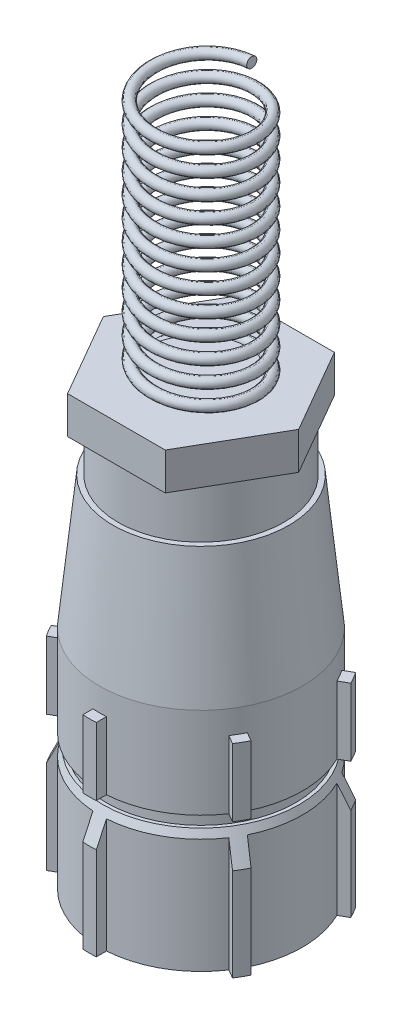
from build123d import *

# Parameters (mm, degrees)
SKETCH_1_R          = 15
EXTRUDE_1_DEPTH     = 33
EXTRUDE_2_DEPTH     = 10
SKETCH_3_R          = 12.25
EXTRUDE_3_DEPTH     = 13
SKETCH_5_R          = 14
EXTRUDE_4_DEPTH     = 2
EXTRUDE_START       = 19
SKETCH_6_R          = 16.5
EXTRUDE_5_DEPTH     = 19
SKETCH_7_R          = 13.5
SKETCH_7_R_2        = 11
CUT_EXTRUDE_2_DEPTH = 9
SKETCH_8_R          = 16.5
SKETCH_8_R_2        = 13.5
CUT_EXTRUDE_3_DEPTH = 1
SKETCH_9_R          = 0.75
CUT_EXTRUDE_4_DEPTH = 4
CHAMFER_1_SIZE      = 2
CHAMFER_1_SIZE2     = 4.289013841
CUT_EXTRUDE_5_DEPTH = 18
SKETCH_11_R         = 7.5
EXTRUDE_6_DEPTH     = 1
SWEEP_1_PITCH       = 3
EXTRUDE_8_DEPTH     = 5.5


with BuildPart() as part:
    # Эскиз1 → Бобышка-Вытянуть1 (new body)
    with BuildSketch(Plane(origin=(0, 0, 0), x_dir=(1, 0, 0), z_dir=(0, 1, 0))):
        with Locations(Location((0, 0, 0), (0, 0, 270))):
            Circle(SKETCH_1_R)
    extrude(amount=EXTRUDE_1_DEPTH)

    # Эскиз2 → Бобышка-Вытянуть2 (add)
    with BuildSketch(Plane.XZ):
        with BuildLine():
            ThreePointArc((1, 16.469669092), (0.500229938, 16.49241553), (0, 16.5))
            Line((0, 16.5), (0, 15))
            ThreePointArc((0, 15), (0.500278319, 14.991655066), (1, 14.966629547))
            Line((1, 14.966629547), (1, 16.469669092))
        make_face()
        with BuildLine():
            Line((0, 15), (0, 16.5))
            ThreePointArc((0, 16.5), (-0.500229938, 16.49241553), (-1, 16.469669092))
            Line((-1, 16.469669092), (-1, 14.966629547))
            ThreePointArc((-1, 14.966629547), (-0.500278319, 14.991655066), (0, 15))
        make_face()
        with BuildLine():
            ThreePointArc((-13.461481397, 6.61728937), (-12.990381057, 7.5), (-12.461481397, 8.349340177))
            Line((-12.461481397, 8.349340177), (-13.763151826, 9.10085995))
            ThreePointArc((-13.763151826, 9.10085995), (-14.289419162, 8.25), (-14.763151826, 7.368809142))
            Line((-14.763151826, 7.368809142), (-13.461481397, 6.61728937))
        make_face()
        with BuildLine():
            Line((13.763151826, 9.10085995), (12.461481397, 8.349340177))
            ThreePointArc((12.461481397, 8.349340177), (12.990381057, 7.5), (13.461481397, 6.61728937))
            Line((13.461481397, 6.61728937), (14.763151826, 7.368809142))
            ThreePointArc((14.763151826, 7.368809142), (14.289419162, 8.25), (13.763151826, 9.10085995))
        make_face()
        with BuildLine():
            ThreePointArc((13.461481397, -6.61728937), (12.990381057, -7.5), (12.461481397, -8.349340177))
            Line((12.461481397, -8.349340177), (13.763151826, -9.10085995))
            ThreePointArc((13.763151826, -9.10085995), (14.289419162, -8.25), (14.763151826, -7.368809142))
            Line((14.763151826, -7.368809142), (13.461481397, -6.61728937))
        make_face()
        with BuildLine():
            Line((0, -16.5), (0, -15))
            ThreePointArc((0, -15), (-0.500278319, -14.991655066), (-1, -14.966629547))
            Line((-1, -14.966629547), (-1, -16.469669092))
            ThreePointArc((-1, -16.469669092), (-0.500229938, -16.49241553), (0, -16.5))
        make_face()
        with BuildLine():
            ThreePointArc((1, -14.966629547), (0.500278319, -14.991655066), (0, -15))
            Line((0, -15), (0, -16.5))
            ThreePointArc((0, -16.5), (0.500229938, -16.49241553), (1, -16.469669092))
            Line((1, -16.469669092), (1, -14.966629547))
        make_face()
        with BuildLine():
            Line((-13.763151826, -9.10085995), (-12.461481397, -8.349340177))
            ThreePointArc((-12.461481397, -8.349340177), (-12.990381057, -7.5), (-13.461481397, -6.61728937))
            Line((-13.461481397, -6.61728937), (-14.763151826, -7.368809142))
            ThreePointArc((-14.763151826, -7.368809142), (-14.289419162, -8.25), (-13.763151826, -9.10085995))
        make_face()
    extrude(amount=-EXTRUDE_2_DEPTH)

    # Эскиз5 → Бобышка-Вытянуть4 (add)
    with BuildSketch(Plane.XZ):
        with Locations(Location((0, 0, 0), (0, 0, 90))):
            Circle(SKETCH_5_R)
    extrude(amount=EXTRUDE_4_DEPTH)

    # Эскиз6 → Бобышка-Вытянуть5 (add)
    with BuildSketch(Plane.XZ.offset(2).offset(EXTRUDE_START)):
        with Locations(Location((0, 0, 0), (0, 0, 270))):
            Circle(SKETCH_6_R)
    extrude(amount=-EXTRUDE_5_DEPTH)

    # Эскиз7 → Вырез-Вытянуть2 (cut)
    with BuildSketch(Plane.XZ.offset(21)):
        with Locations(Location((0, 0, 0), (0, 0, 270))):
            Circle(SKETCH_7_R)
        with Locations(Location((0, 0, 0), (0, 0, 270))):
            Circle(SKETCH_7_R_2, mode=Mode.SUBTRACT)
    extrude(amount=-CUT_EXTRUDE_2_DEPTH, mode=Mode.SUBTRACT)

    # Эскиз8 → Вырез-Вытянуть3 (cut)
    with BuildSketch(Plane.XZ.offset(21)):
        with Locations(Location((0, 0, 0), (0, 0, 270))):
            Circle(SKETCH_8_R)
        with Locations(Location((0, 0, 0), (0, 0, 270))):
            Circle(SKETCH_8_R_2, mode=Mode.SUBTRACT)
    extrude(amount=-CUT_EXTRUDE_3_DEPTH, mode=Mode.SUBTRACT)

    # Эскиз9 → Вырез-Вытянуть4 (cut)
    with BuildSketch(Plane.XZ.offset(21)):
        with Locations(Location((-1.5, -2.598076211, 0), (0, 0, 270))):
            Circle(SKETCH_9_R)
        with Locations(Location((-3, 0, 0), (0, 0, 270))):
            Circle(SKETCH_9_R)
        with Locations(Location((0, 0, 0), (0, 0, 270))):
            Circle(SKETCH_9_R)
        with Locations(Location((1.5, -2.598076211, 0), (0, 0, 270))):
            Circle(SKETCH_9_R)
        with Locations(Location((3, 0, 0), (0, 0, 270))):
            Circle(SKETCH_9_R)
        with Locations(Location((3, -5.196152423, 0), (0, 0, 270))):
            Circle(SKETCH_9_R)
        with Locations(Location((6, 0, 0), (0, 0, 270))):
            Circle(SKETCH_9_R)
        with Locations(Location((-3, -5.196152423, 0), (0, 0, 270))):
            Circle(SKETCH_9_R)
        with Locations(Location((-4.5, -7.794228634, 0), (0, 0, 270))):
            Circle(SKETCH_9_R)
        with Locations(Location((4.5, -7.794228634, 0), (0, 0, 270))):
            Circle(SKETCH_9_R)
        with Locations(Location((9, 0, 0), (0, 0, 270))):
            Circle(SKETCH_9_R)
        with Locations(Location((-6, 0, 0), (0, 0, 270))):
            Circle(SKETCH_9_R)
        with Locations(Location((-9, 0, 0), (0, 0, 270))):
            Circle(SKETCH_9_R)
        with Locations(Location((-1.5, 2.598076211, 0), (0, 0, 270))):
            Circle(SKETCH_9_R)
        with Locations(Location((1.5, 2.598076211, 0), (0, 0, 270))):
            Circle(SKETCH_9_R)
        with Locations(Location((3, 5.196152423, 0), (0, 0, 270))):
            Circle(SKETCH_9_R)
        with Locations(Location((4.5, 7.794228634, 0), (0, 0, 270))):
            Circle(SKETCH_9_R)
        with Locations(Location((-3, 5.196152423, 0), (0, 0, 270))):
            Circle(SKETCH_9_R)
        with Locations(Location((-4.5, 7.794228634, 0), (0, 0, 270))):
            Circle(SKETCH_9_R)
    extrude(amount=-CUT_EXTRUDE_4_DEPTH, mode=Mode.SUBTRACT)

    # Фаска1
    chamfer_1_edges = [part.edges().sort_by_distance(p)[0] for p in [
        (0, -2, 16.5),
    ]]
    chamfer_1_side = [part.faces().sort_by_distance(p)[0] for p in [
        (0, -2, 16.033309524),
    ]]
    chamfer(chamfer_1_edges, length=CHAMFER_1_SIZE, length2=CHAMFER_1_SIZE2, reference=chamfer_1_side[0])

    # Эскиз10 → Вырез-Вытянуть5 (cut)
    with BuildSketch(Plane.XZ.offset(20)):
        with BuildLine():
            Line((1, 14.966629547), (1, 16.469669092))
            ThreePointArc((1, 16.469669092), (8.25, 14.289419162), (13.763151826, 9.10085995))
            Line((13.763151826, 9.10085995), (12.461481397, 8.349340177))
            ThreePointArc((12.461481397, 8.349340177), (7.5, 12.990381057), (1, 14.966629547))
        make_face()
        with BuildLine():
            Line((-1, 16.469669092), (-1, 14.966629547))
            ThreePointArc((-1, 14.966629547), (-7.5, 12.990381057), (-12.461481397, 8.349340177))
            Line((-12.461481397, 8.349340177), (-13.763151826, 9.10085995))
            ThreePointArc((-13.763151826, 9.10085995), (-8.25, 14.289419162), (-1, 16.469669092))
        make_face()
        with BuildLine():
            Line((-14.763151826, 7.368809142), (-13.461481397, 6.61728937))
            ThreePointArc((-13.461481397, 6.61728937), (-15, 0), (-13.461481397, -6.61728937))
            Line((-13.461481397, -6.61728937), (-14.763151826, -7.368809142))
            ThreePointArc((-14.763151826, -7.368809142), (-16.5, 0), (-14.763151826, 7.368809142))
        make_face()
        with BuildLine():
            Line((-13.763151826, -9.10085995), (-12.461481397, -8.349340177))
            ThreePointArc((-12.461481397, -8.349340177), (-7.5, -12.990381057), (-1, -14.966629547))
            Line((-1, -14.966629547), (-1, -16.469669092))
            ThreePointArc((-1, -16.469669092), (-8.25, -14.289419162), (-13.763151826, -9.10085995))
        make_face()
        with BuildLine():
            Line((1, -16.469669092), (1, -14.966629547))
            ThreePointArc((1, -14.966629547), (7.5, -12.990381057), (12.461481397, -8.349340177))
            Line((12.461481397, -8.349340177), (13.763151826, -9.10085995))
            ThreePointArc((13.763151826, -9.10085995), (8.25, -14.289419162), (1, -16.469669092))
        make_face()
        with BuildLine():
            Line((14.763151826, -7.368809142), (13.461481397, -6.61728937))
            ThreePointArc((13.461481397, -6.61728937), (15, 0), (13.461481397, 6.61728937))
            Line((13.461481397, 6.61728937), (14.763151826, 7.368809142))
            ThreePointArc((14.763151826, 7.368809142), (16.5, 0), (14.763151826, -7.368809142))
        make_face()
    extrude(amount=-CUT_EXTRUDE_5_DEPTH, mode=Mode.SUBTRACT)

    # Эскиз11 → Бобышка-Вытянуть6 (add)
    with BuildSketch(Plane(origin=(0, 33, 0), x_dir=(1, 0, 0), z_dir=(0, 1, 0))):
        with Locations(Location((0, 0, 0), (0, 0, 270))):
            Circle(SKETCH_11_R)
    extrude(amount=EXTRUDE_6_DEPTH)

    # По траектории1: arcs per turn and ends read off the stored shape
    # По траектории1: the profile of Эскиз15 screwed along a left-hand helix through 16 turns, 10 arcs to a turn; built about Z, then put on its axis
    sweep_1_z = Axis((0, 0, 0), (0, 0, 1))
    sweep_1_corners = [(8.25, 0, 0), (7.5, 0, 0.75), (6.75, 0, 0), (7.5, 0, -0.75)]
    with BuildLine(mode=Mode.PRIVATE) as sweep_1_profile:
        ThreePointArc((8.25, 0, 0), (8.030330086, 0, 0.530330086), (7.5, 0, 0.75))
        ThreePointArc((7.5, 0, 0.75), (6.969669914, 0, 0.530330086), (6.75, 0, 0))
        ThreePointArc((6.75, 0, 0), (6.969669914, 0, -0.530330086), (7.5, 0, -0.75))
        ThreePointArc((7.5, 0, -0.75), (8.030330086, 0, -0.530330086), (8.25, 0, 0))
    sweep_1_cap = Face(sweep_1_profile.wire())
    sweep_1_arcs = [((8.25, 0, 0), (8.25, 0, 0.75), (7.5, 0, 0.75), (1, 0.7071067811865476, 1)), ((7.5, 0, 0.75), (6.75, 0, 0.75), (6.75, 0, 0), (1, 0.7071067811865476, 1)), ((6.75, 0, 0), (6.75, 0, -0.75), (7.5, 0, -0.75), (1, 0.7071067811865476, 1)), ((7.5, 0, -0.75), (8.25, 0, -0.75), (8.25, 0, 0), (1, 0.7071067811865476, 1))]  # start, shoulder, end, weights
    sweep_1_turn_angles = [0, -18, -36, -54, -72, -90, -108, -126, -144, -162, -180, -198, -216, -234, -252, -270, -288, -306, -324, -342, -360]
    sweep_1_turn_weights = [1, 0.9510565162951535, 1, 0.9510565162951535, 1, 0.9510565162951535, 1, 0.9510565162951535, 1, 0.9510565162951535, 1, 0.9510565162951535, 1, 0.9510565162951535, 1, 0.9510565162951535, 1, 0.9510565162951535, 1, 0.9510565162951535, 1]
    sweep_1_turn_sides = [Face.make_bezier_surface([[Vector(p[j][0], p[j][1], 0).rotate(sweep_1_z, sweep_1_turn_angles[2 * i + k]) / sweep_1_turn_weights[2 * i + k] + Vector(0, 0, p[j][2] + -SWEEP_1_PITCH * sweep_1_turn_angles[2 * i + k] / 360) for k in range(3)] for j in range(3)], [[p[3][j] * sweep_1_turn_weights[2 * i + k] for k in range(3)] for j in range(3)]) for p in sweep_1_arcs for i in range(10)]
    sweep_1 = Plane(origin=(0, 34, 0), x_dir=(0, 0, -1), z_dir=(0, 1, 0)) * Solid(Shell([*[p.moved(Location((0, 0, SWEEP_1_PITCH * i))) for i in range(16) for p in sweep_1_turn_sides], sweep_1_cap, sweep_1_cap.rotate(sweep_1_z, -5760).moved(Location((0, 0, -SWEEP_1_PITCH * -5760 / 360)))]))
    add(sweep_1)



with BuildPart() as body_2:
    # Эскиз3 → Бобышка-Вытянуть3 (new body)
    with BuildSketch(Plane(origin=(0, 33, 0), x_dir=(1, 0, 0), z_dir=(0, 1, 0))):
        with Locations(Location((0, 0, 0), (0, 0, 90))):
            Circle(SKETCH_3_R)
    extrude(amount=EXTRUDE_3_DEPTH)


with BuildPart() as part_1:
    add(part.part)

    add(body_2.part)  # Бобышка-Вытянуть8 merges body 2
    # Эскиз18 → Бобышка-Вытянуть8 (add)
    with BuildSketch(Plane(origin=(0, 46, 0), x_dir=(1, 0, 0), z_dir=(0, 1, 0))):
        Polygon((14.43375673, 0), (7.216878365, 12.5), (-7.216878365, 12.5), (-14.43375673, 0), (-7.216878365, -12.5), (7.216878365, -12.5), align=None)
    extrude(amount=-EXTRUDE_8_DEPTH)

    # Эскиз19 → Вырез-Повернуть1 (revolve, cut)
    with BuildSketch(Plane.XY, mode=Mode.PRIVATE) as cut_revolve_1_sk:
        Polygon((-15, 33), (-15, 13.425636656), (-13, 33), align=None)
    revolve(cut_revolve_1_sk.sketch.rotate(Axis((0, -21, 0), (0, 1, 0)), 270), axis=Axis((0, -21, 0), (0, 1, 0)), mode=Mode.SUBTRACT)


solid = part_1.part
